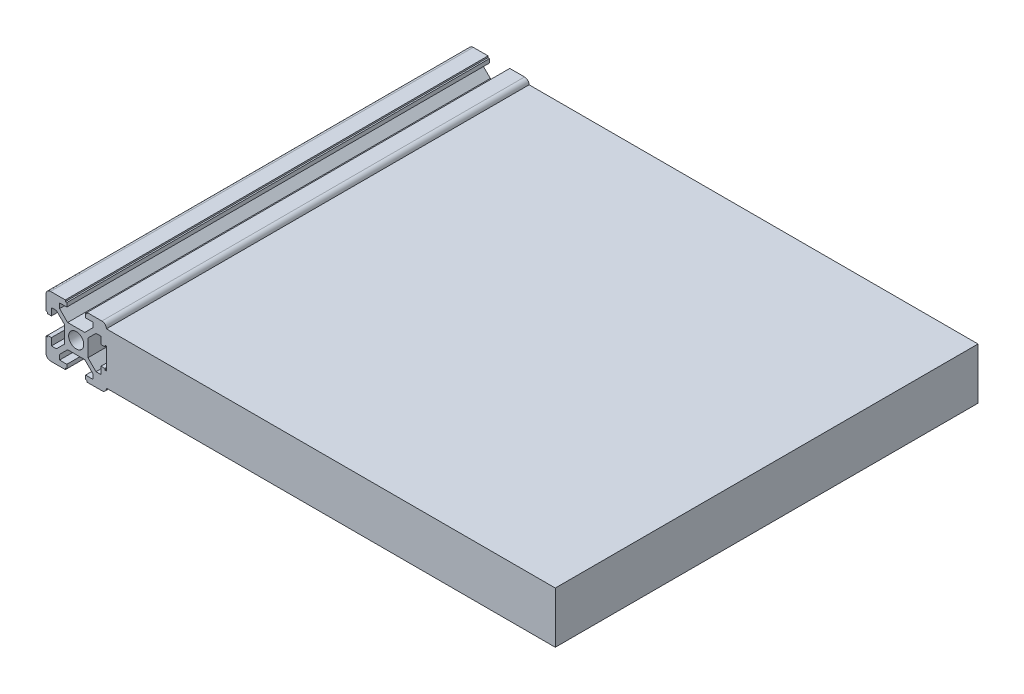
from build123d import *

# Parameters (mm, degrees)
SKETCH1_R           = 2.5
BOSS_EXTRUDE1_DEPTH = 140
SCALE_2_SCALE       = 3
SCALE_3_SCALE       = 6
SCALE_5_SCALE       = 2
SCALE_6_SCALE       = 0.25
SCALE_7_SCALE       = 0.125
SCALE_8_SCALE       = 0.25
SCALE_9_SCALE       = 4
SCALE_10_SCALE      = 4
OTHER_START         = -17.55
OTHER_1_OUTLINE_R   = 5
OTHER_1_DEPTH       = 10
SKETCH_11_W         = 630
SKETCH_11_H         = 76.5
EXTRUDE_1_DEPTH     = 669


# Read off the part's stored shape, not the designer's step: 孔1
with BuildPart() as part:
    # Sketch1 → Boss-Extrude1 (new body)
    with BuildSketch(Plane.XY):
        with BuildLine():
            Line((2.839339828, 3.9), (5.5, 6.560660172))
            Line((5.5, 6.560660172), (5.5, 8.2))
            Line((5.5, 8.2), (3.1, 8.2))
            Line((3.1, 8.2), (3.1, 9.5))
            Line((3.1, 9.5), (3.6, 9.5))
            Line((3.6, 9.5), (3.6, 10))
            Line((3.6, 10), (8.5, 10))
            ThreePointArc((8.5, 10), (9.560660172, 9.560660172), (10, 8.5))
            Line((10, 8.5), (10, 3.6))
            Line((10, 3.6), (9.5, 3.6))
            Line((9.5, 3.6), (9.5, 3.1))
            Line((9.5, 3.1), (8.2, 3.1))
            Line((8.2, 3.1), (8.2, 5.5))
            Line((8.2, 5.5), (6.560660172, 5.5))
            Line((6.560660172, 5.5), (3.9, 2.839339828))
            Line((3.9, 2.839339828), (3.9, -2.839339828))
            Line((3.9, -2.839339828), (6.560660172, -5.5))
            Line((6.560660172, -5.5), (8.2, -5.5))
            Line((8.2, -5.5), (8.2, -3.1))
            Line((8.2, -3.1), (9.5, -3.1))
            Line((9.5, -3.1), (9.5, -3.6))
            Line((9.5, -3.6), (10, -3.6))
            Line((10, -3.6), (10, -8.5))
            ThreePointArc((10, -8.5), (9.560660172, -9.560660172), (8.5, -10))
            Line((8.5, -10), (3.6, -10))
            Line((3.6, -10), (3.6, -9.5))
            Line((3.6, -9.5), (3.1, -9.5))
            Line((3.1, -9.5), (3.1, -8.2))
            Line((3.1, -8.2), (5.5, -8.2))
            Line((5.5, -8.2), (5.5, -6.560660172))
            Line((5.5, -6.560660172), (2.839339828, -3.9))
            Line((2.839339828, -3.9), (-2.839339828, -3.9))
            Line((-2.839339828, -3.9), (-5.5, -6.560660172))
            Line((-5.5, -6.560660172), (-5.5, -8.2))
            Line((-5.5, -8.2), (-3.1, -8.2))
            Line((-3.1, -8.2), (-3.1, -9.5))
            Line((-3.1, -9.5), (-3.6, -9.5))
            Line((-3.6, -9.5), (-3.6, -10))
            Line((-3.6, -10), (-8.5, -10))
            ThreePointArc((-8.5, -10), (-9.560660172, -9.560660172), (-10, -8.5))
            Line((-10, -8.5), (-10, -3.6))
            Line((-10, -3.6), (-9.5, -3.6))
            Line((-9.5, -3.6), (-9.5, -3.1))
            Line((-9.5, -3.1), (-8.2, -3.1))
            Line((-8.2, -3.1), (-8.2, -5.5))
            Line((-8.2, -5.5), (-6.560660172, -5.5))
            Line((-6.560660172, -5.5), (-3.9, -2.839339828))
            Line((-3.9, -2.839339828), (-3.9, 2.839339828))
            Line((-3.9, 2.839339828), (-6.560660172, 5.5))
            Line((-6.560660172, 5.5), (-8.2, 5.5))
            Line((-8.2, 5.5), (-8.2, 3.1))
            Line((-8.2, 3.1), (-9.5, 3.1))
            Line((-9.5, 3.1), (-9.5, 3.6))
            Line((-9.5, 3.6), (-10, 3.6))
            Line((-10, 3.6), (-10, 8.5))
            ThreePointArc((-10, 8.5), (-9.560660172, 9.560660172), (-8.5, 10))
            Line((-8.5, 10), (-3.6, 10))
            Line((-3.6, 10), (-3.6, 9.5))
            Line((-3.6, 9.5), (-3.1, 9.5))
            Line((-3.1, 9.5), (-3.1, 8.2))
            Line((-3.1, 8.2), (-5.5, 8.2))
            Line((-5.5, 8.2), (-5.5, 6.560660172))
            Line((-5.5, 6.560660172), (-2.839339828, 3.9))
            Line((-2.839339828, 3.9), (2.839339828, 3.9))
        make_face()
        with Locations((0, 0.235847297)):
            Circle(SKETCH1_R, mode=Mode.SUBTRACT)
    extrude(amount=BOSS_EXTRUDE1_DEPTH)


with BuildPart() as part_1:
    # 缩放比例2: scaled about (0, -0.027095247, 70)
    add(part.part.scale(SCALE_2_SCALE).moved(Location((0, 0.054190494, -140))))


with BuildPart() as part_2:
    # 缩放比例3: scaled about (0, -0.027095247, 70)
    add(part_1.part.scale(SCALE_3_SCALE).moved(Location((0, 0.135476235, -350))))


with BuildPart() as part_3:
    # 缩放比例5: scaled about (0, -0.027095249, 70)
    add(part_2.part.scale(SCALE_5_SCALE).moved(Location((0, 0.027095249, -70))))


with BuildPart() as part_4:
    # 缩放比例6: scaled about (0, -0.027095249, 70)
    add(part_3.part.scale(SCALE_6_SCALE).moved(Location((0, -0.020321437, 52.5))))


with BuildPart() as part_5:
    # 缩放比例7: scaled about (0, -0.027095249, 70)
    add(part_4.part.scale(SCALE_7_SCALE).moved(Location((0, -0.023708343, 61.25))))


with BuildPart() as part_6:
    # 缩放比例8: scaled about (0, -0.027095249, 70)
    add(part_5.part.scale(SCALE_8_SCALE).moved(Location((0, -0.020321437, 52.5))))


with BuildPart() as part_7:
    # 缩放比例9: scaled about (0, -0.027095249, 70)
    add(part_6.part.scale(SCALE_9_SCALE).moved(Location((0, 0.081285747, -210))))


with BuildPart() as part_8:
    # 缩放比例10: scaled about (0, -0.027095249, 70)
    add(part_7.part.scale(SCALE_10_SCALE).moved(Location((0, 0.081285747, -210))))

    # 孔1 outline → 孔1 (cut)
    with BuildSketch(Plane.YZ.offset(OTHER_START)):
        with Locations((7.344833538, 1.297306883)):
            Circle(OTHER_1_OUTLINE_R)
    extrude(amount=OTHER_1_DEPTH, mode=Mode.SUBTRACT)

    # 草图11 → 凸台-拉伸1 (add)
    with BuildSketch(Plane(origin=(45, 0, 0), x_dir=(0, 0, -1), z_dir=(1, 0, 0))):
        with Locations((-70, 0.094833365)):
            Rectangle(SKETCH_11_W, SKETCH_11_H)
    extrude(amount=EXTRUDE_1_DEPTH)


solid = part_8.part
